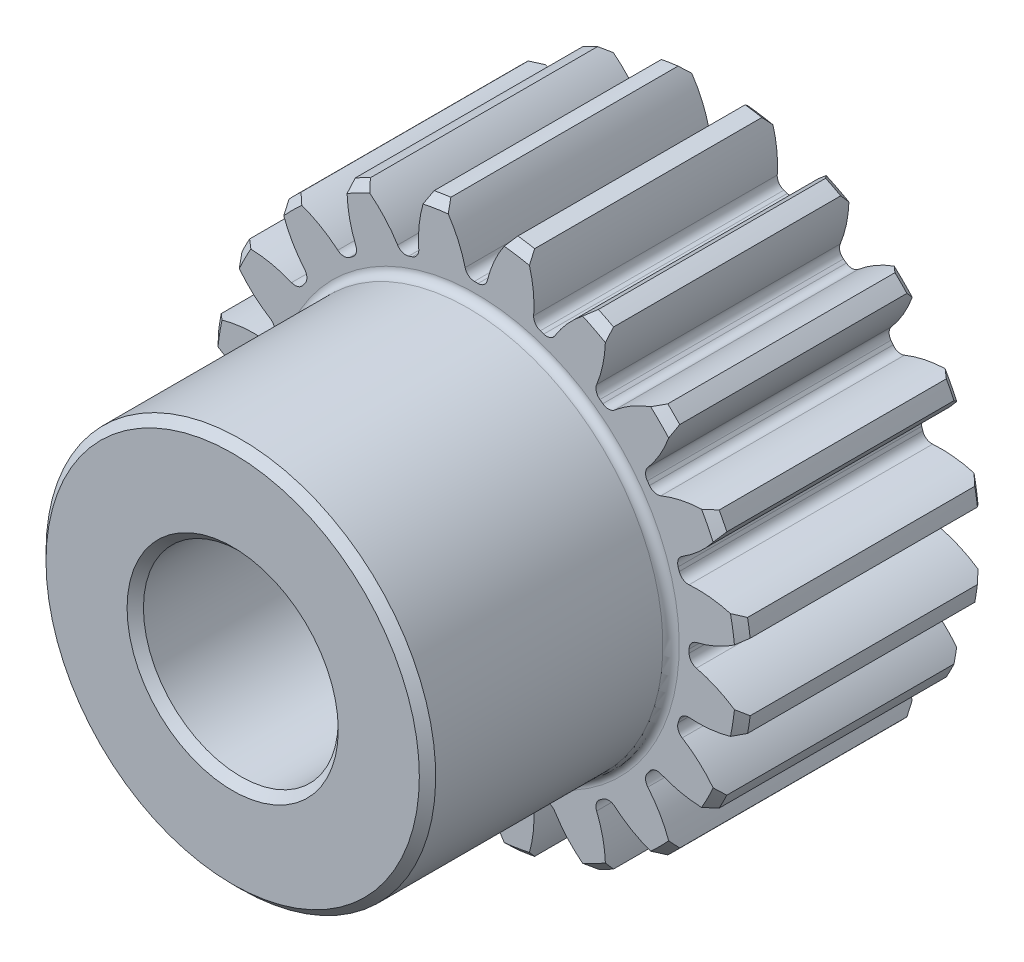
from build123d import *

# Parameters (mm, degrees)
BOSS_EXTRUDE1_DEPTH      = 10
BOSS_EXTRUDE1_DEPTH_BACK = 10
SKETCH3_R                = 11
SKETCH5_W                = 10
SKETCH5_H                = 3
SKETCH5_W_2              = 20
SKETCH5_H_2              = 4
FILLET2_R                = 0.335505036
CHAMFER1_SIZE            = 0.335505036
CUT_EXTRUDE1_DEPTH       = 19.493242009
FILLET1_R                = 0.392699082
CIRPATTERN1_COUNT        = 20
FILLET1_OF_CIRPATTERN1_R = 0.392699082


with BuildPart() as part:
    # Sketch3 → Boss-Extrude1 (new, two sides: drawn at the far end of the back side and taken through both)
    with BuildSketch(Plane.XY.offset(-BOSS_EXTRUDE1_DEPTH_BACK)):
        Circle(SKETCH3_R)
    extrude(amount=BOSS_EXTRUDE1_DEPTH + BOSS_EXTRUDE1_DEPTH_BACK)

    # Sketch5 → Cut-Revolve1 (revolve, cut)
    with BuildSketch(Plane(origin=(0, 0, 0), x_dir=(0, 0, -1), z_dir=(1, 0, 0)), mode=Mode.PRIVATE) as cut_revolve1_sk:
        with Locations((-5, 9.5)):
            Rectangle(SKETCH5_W, SKETCH5_H)
        with Locations((0, 2)):
            Rectangle(SKETCH5_W_2, SKETCH5_H_2)
    revolve(cut_revolve1_sk.sketch.rotate(Axis((0, 0, 10), (0, 0, -1)), 180), axis=Axis((0, 0, 10), (0, 0, -1)), mode=Mode.SUBTRACT)

    # Fillet2
    fillet2_edges = [part.edges().sort_by_distance(p)[0] for p in [
        (0, 8, 0),
    ]]
    fillet(fillet2_edges, radius=FILLET2_R)

    # Chamfer1
    chamfer1_edges = [part.edges().sort_by_distance(p)[0] for p in [
        (0, 4, 10),
        (0, 4, -10),
        (-11, 0, 0),
        (0, 8, 10),
        (-11, 0, -10),
    ]]
    chamfer(chamfer1_edges, length=CHAMFER1_SIZE)

    # Sketch4 → Cut-Extrude1 (cut, symmetric)
    with BuildSketch(Plane.XY):
        with BuildLine():
            Line((8.741183411, 0.392699082), (8.741183411, -0.392699082))
            ThreePointArc((8.741183411, -0.392699082), (9.888365612, -0.750049536), (10.913495279, -1.376815454))
            ThreePointArc((10.913495279, -1.376815454), (11, 0), (10.913495279, 1.376815454))
            ThreePointArc((10.913495279, 1.376815454), (9.888365612, 0.750049536), (8.741183411, 0.392699082))
        make_face()
    cut_extrude1 = extrude(amount=CUT_EXTRUDE1_DEPTH, both=True, mode=Mode.SUBTRACT)

    # Fillet1
    fillet1_edges = [part.edges().sort_by_distance(p)[0] for p in [
        (8.741183411, 0.392699082, -5),
        (8.741183411, -0.392699082, -5),
    ]]
    fillet(fillet1_edges, radius=FILLET1_R)

    # CirPattern1: Cut-Extrude1 ×20 about axis
    cirpattern1_axis = Axis((0, 0, 0), (0, 0, 1))
    for i in range(1, CIRPATTERN1_COUNT):
        add(cut_extrude1.rotate(cirpattern1_axis, i * 360 / CIRPATTERN1_COUNT), mode=Mode.SUBTRACT)

    # Fillet1 of CirPattern1
    fillet1_of_cirpattern1_edges = [part.edges().sort_by_distance(p)[0] for p in [
        (8.192008754, 3.074653246, -5),
        (8.434710133, 2.327695204, -5),
        (6.840943202, 5.455638928, -5),
        (7.30258866, 4.820238466, -5),
        (4.820238466, 7.30258866, -5),
        (5.455638928, 6.840943202, -5),
        (2.327695204, 8.434710133, -5),
        (3.074653246, 8.192008754, -5),
        (-0.392699082, 8.741183411, -5),
        (0.392699082, 8.741183411, -5),
        (-3.074653246, 8.192008754, -5),
        (-2.327695204, 8.434710133, -5),
        (-5.455638928, 6.840943202, -5),
        (-4.820238466, 7.30258866, -5),
        (-7.30258866, 4.820238466, -5),
        (-6.840943202, 5.455638928, -5),
        (-8.434710133, 2.327695204, -5),
        (-8.192008754, 3.074653246, -5),
        (-8.741183411, -0.392699082, -5),
        (-8.741183411, 0.392699082, -5),
        (-8.192008754, -3.074653246, -5),
        (-8.434710133, -2.327695204, -5),
        (-6.840943202, -5.455638928, -5),
        (-7.30258866, -4.820238466, -5),
        (-4.820238466, -7.30258866, -5),
        (-5.455638928, -6.840943202, -5),
        (-2.327695204, -8.434710133, -5),
        (-3.074653246, -8.192008754, -5),
        (0.392699082, -8.741183411, -5),
        (-0.392699082, -8.741183411, -5),
        (3.074653246, -8.192008754, -5),
        (2.327695204, -8.434710133, -5),
        (5.455638928, -6.840943202, -5),
        (4.820238466, -7.30258866, -5),
        (7.30258866, -4.820238466, -5),
        (6.840943202, -5.455638928, -5),
        (8.434710133, -2.327695204, -5),
        (8.192008754, -3.074653246, -5),
    ]]
    fillet(fillet1_of_cirpattern1_edges, radius=FILLET1_OF_CIRPATTERN1_R)


solid = part.part
